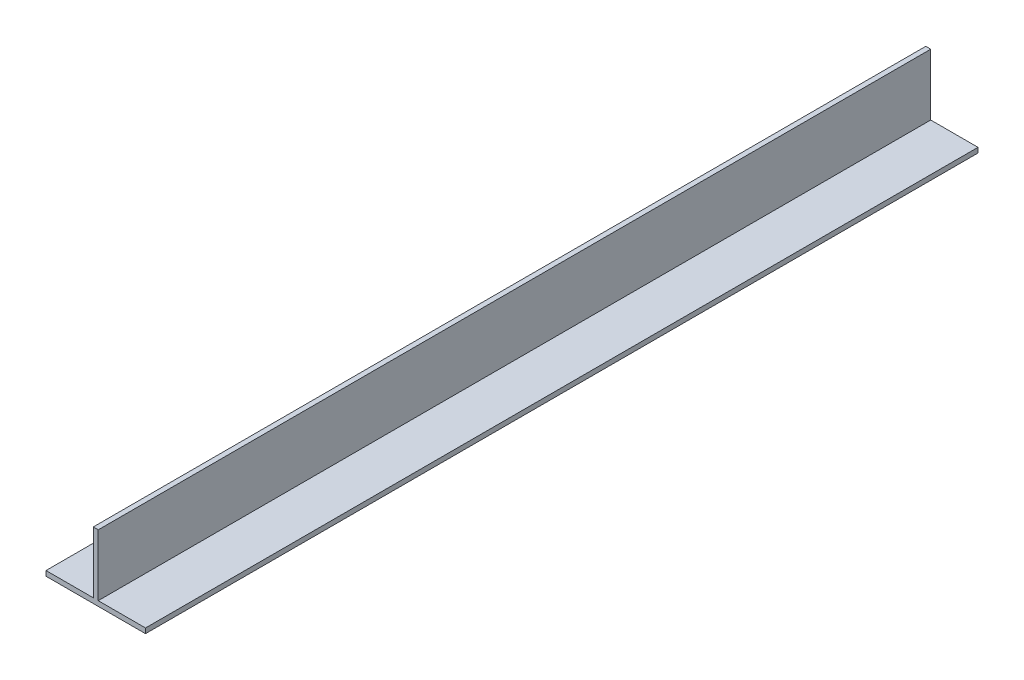
from build123d import *

# Parameters (mm, degrees)
EXTRUDE_1_DEPTH = 251


with BuildPart() as part:
    # Эскиз1 → Бобышка-Вытянуть1 (new body)
    with BuildSketch(Plane.XY):
        Polygon((0, 0), (0, 18.5), (1.5, 18.5), (1.5, 0), (15.75, 0), (15.75, -1.5), (-14.25, -1.5), (-14.25, 0), align=None)
    extrude(amount=EXTRUDE_1_DEPTH)


solid = part.part
